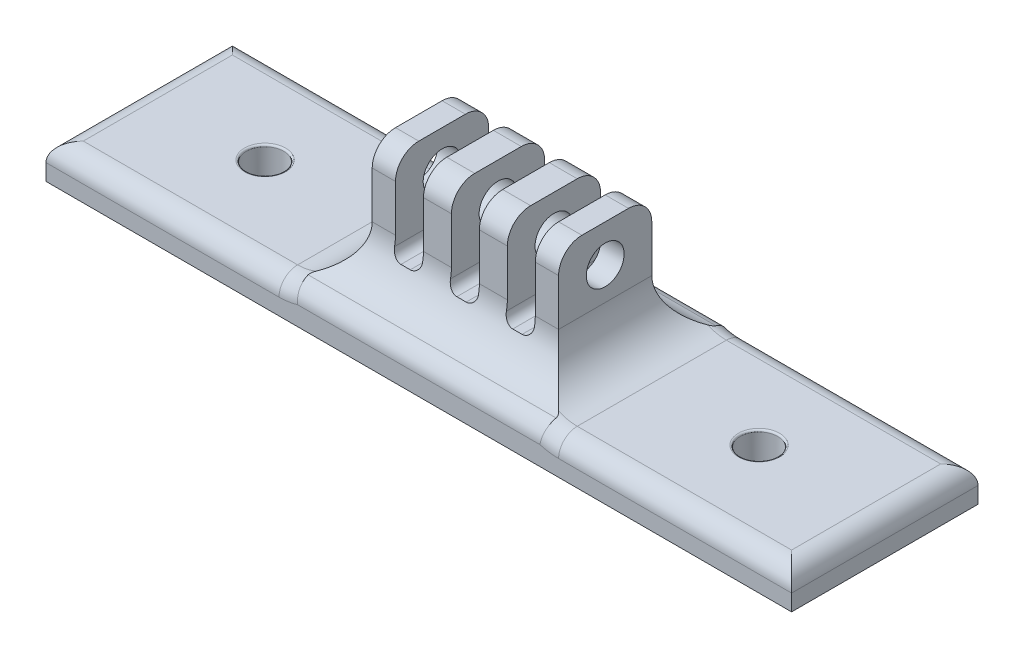
from build123d import *
from build123d.topology import SkipClean

# Parameters (mm, degrees)
SKETCH1_W           = 101.6
SKETCH1_H           = 25.4
BOSS_EXTRUDE1_DEPTH = 4.7625
SKETCH2_W           = 25.4
SKETCH2_H           = 12.7
BOSS_EXTRUDE2_DEPTH = 15.875
SKETCH3_W           = 3.81
SKETCH3_H           = 12.065
CUT_EXTRUDE1_DEPTH  = 25.4
SKETCH4_R           = 2.5781
CUT_EXTRUDE2_DEPTH  = 72.4375
FILLET2_START       = 45.085
FILLET2_DEPTH       = 3.81
FILLET2_START_2     = 52.705
FILLET2_2_DEPTH     = 3.81
FILLET2_START_3     = 38.1
FILLET2_3_DEPTH     = 3.175
FILLET2_START_4     = 60.325
FILLET2_4_DEPTH     = 3.175
FILLET2_START_5     = -25.4
FILLET2_5_OUTLINE_W = 3.81
FILLET2_5_OUTLINE_H = 3.81
FILLET2_5_DEPTH     = 25.4
FILLET2_6_DEPTH     = 101.6
FILLET3_2_DEPTH     = 101.6
FILLET3_3_DEPTH     = 31.75
FILLET3_START       = 69.85
FILLET3_4_DEPTH     = 31.75
FILLET3_START_2     = -26
FILLET3_5_DEPTH     = 27
FILLET4_R           = 3.175
FILLET5_R           = 1.27
SKETCH5_R           = 2.5527
CUT_EXTRUDE3_DEPTH  = 106.923253491
FILLET6_R           = 0.254


with BuildPart() as part:
    # Sketch1 → Boss-Extrude1 (new body)
    with BuildSketch(Plane(origin=(0, 0, 0), x_dir=(1, 0, 0), z_dir=(0, 1, 0))):
        with Locations((50.8, 12.7)):
            Rectangle(SKETCH1_W, SKETCH1_H)
    extrude(amount=BOSS_EXTRUDE1_DEPTH)

    # Sketch2 → Boss-Extrude2 (add)
    with BuildSketch(Plane(origin=(0, 4.7625, 0), x_dir=(1, 0, 0), z_dir=(0, 1, 0))):
        with Locations((50.8, 12.7)):
            Rectangle(SKETCH2_W, SKETCH2_H)
    extrude(amount=BOSS_EXTRUDE2_DEPTH)

    # Sketch3 → Cut-Extrude1 (cut)
    with BuildSketch(Plane.XY.offset(-6.35)):
        with Locations((50.8, 14.605)):
            Rectangle(SKETCH3_W, SKETCH3_H)
        with Locations((43.18, 14.605)):
            Rectangle(SKETCH3_W, SKETCH3_H)
        with Locations((58.42, 14.605)):
            Rectangle(SKETCH3_W, SKETCH3_H)
    extrude(amount=-CUT_EXTRUDE1_DEPTH, mode=Mode.SUBTRACT)

    # Sketch4 → Cut-Extrude2 (cut, through all)
    with BuildSketch(Plane(origin=(63.5, 0, 0), x_dir=(0, 0, -1), z_dir=(1, 0, 0))):
        with Locations((12.7, 15.5575)):
            Circle(SKETCH4_R)
    extrude(amount=-CUT_EXTRUDE2_DEPTH, mode=Mode.SUBTRACT)

    # Fillet2: read off the stored shape, not the designer's step
    # Fillet2 outline → Fillet2 (add)
    with BuildSketch(Plane.YZ.offset(FILLET2_START)):
        with BuildLine():
            Line((4.7625, -6.35), (11.1125, -6.35))
            ThreePointArc((11.1125, -6.35), (6.622371939, -4.490128061), (4.7625, 0))
            Line((4.7625, 0), (4.7625, -6.35))
        make_face()
        with BuildLine():
            Line((11.1125, -19.05), (4.7625, -19.05))
            Line((4.7625, -19.05), (4.7625, -25.4))
            ThreePointArc((4.7625, -25.4), (6.622371939, -20.909871939), (11.1125, -19.05))
        make_face()
    extrude(amount=FILLET2_DEPTH)

    # Fillet2 2 outline → Fillet2 2 (add)
    with BuildSketch(Plane.YZ.offset(FILLET2_START_2)):
        with BuildLine():
            Line((4.7625, -6.35), (11.1125, -6.35))
            ThreePointArc((11.1125, -6.35), (6.622371939, -4.490128061), (4.7625, 0))
            Line((4.7625, 0), (4.7625, -6.35))
        make_face()
        with BuildLine():
            Line((11.1125, -19.05), (4.7625, -19.05))
            Line((4.7625, -19.05), (4.7625, -25.4))
            ThreePointArc((4.7625, -25.4), (6.622371939, -20.909871939), (11.1125, -19.05))
        make_face()
    extrude(amount=FILLET2_2_DEPTH)

    # Fillet2 3 outline → Fillet2 3 (add)
    with BuildSketch(Plane.YZ.offset(FILLET2_START_3)):
        with BuildLine():
            Line((4.7625, -6.35), (11.1125, -6.35))
            ThreePointArc((11.1125, -6.35), (6.622371939, -4.490128061), (4.7625, 0))
            Line((4.7625, 0), (4.7625, -6.35))
        make_face()
        with BuildLine():
            Line((11.1125, -19.05), (4.7625, -19.05))
            Line((4.7625, -19.05), (4.7625, -25.4))
            ThreePointArc((4.7625, -25.4), (6.622371939, -20.909871939), (11.1125, -19.05))
        make_face()
    extrude(amount=FILLET2_3_DEPTH)

    # Fillet2 4 outline → Fillet2 4 (add)
    with BuildSketch(Plane.YZ.offset(FILLET2_START_4)):
        with BuildLine():
            Line((4.7625, -6.35), (11.1125, -6.35))
            ThreePointArc((11.1125, -6.35), (6.622371939, -4.490128061), (4.7625, 0))
            Line((4.7625, 0), (4.7625, -6.35))
        make_face()
        with BuildLine():
            Line((11.1125, -19.05), (4.7625, -19.05))
            Line((4.7625, -19.05), (4.7625, -25.4))
            ThreePointArc((4.7625, -25.4), (6.622371939, -20.909871939), (11.1125, -19.05))
        make_face()
    extrude(amount=FILLET2_4_DEPTH)

    # Fillet2 5 outline → Fillet2 5 (add)
    with BuildSketch(Plane.XY.offset(FILLET2_START_5)):
        with BuildLine():
            ThreePointArc((69.85, 4.7625), (65.359871939, 6.622371939), (63.5, 11.1125))
            Line((63.5, 11.1125), (63.5, 4.7625))
            Line((63.5, 4.7625), (69.85, 4.7625))
        make_face()
        with BuildLine():
            Line((38.1, 4.7625), (38.1, 11.1125))
            ThreePointArc((38.1, 11.1125), (36.240128061, 6.622371939), (31.75, 4.7625))
            Line((31.75, 4.7625), (38.1, 4.7625))
        make_face()
        with Locations((58.42, 6.6675)):
            Rectangle(FILLET2_5_OUTLINE_W, FILLET2_5_OUTLINE_H)
        with Locations((43.18, 6.6675)):
            Rectangle(FILLET2_5_OUTLINE_W, FILLET2_5_OUTLINE_H)
        with Locations((50.8, 6.6675)):
            Rectangle(FILLET2_5_OUTLINE_W, FILLET2_5_OUTLINE_H)
    extrude(amount=FILLET2_5_DEPTH)

    # Fillet2 6 outline → Fillet2 6 (cut)
    with SkipClean():  # the faces are left unmerged after this step: merging them gives an invalid solid
        with BuildSketch(Plane.YZ):
            with BuildLine():
                Line((11.1125, -6.35), (13, -6.35))
                Line((13, -6.35), (13, 0))
                Line((13, 0), (4.7625, 0))
                ThreePointArc((4.7625, 0), (6.622371939, -4.490128061), (11.1125, -6.35))
            make_face()
            with BuildLine():
                Line((4.7625, -25.4), (13, -25.4))
                Line((13, -25.4), (13, -19.05))
                Line((13, -19.05), (11.1125, -19.05))
                ThreePointArc((11.1125, -19.05), (6.622371939, -20.909871939), (4.7625, -25.4))
            make_face()
        extrude(amount=FILLET2_6_DEPTH, mode=Mode.SUBTRACT)
    add(part.part.scale(1), mode=Mode.REPLACE)  # the faces are merged on a copy

    # Fillet3: read off the stored shape, not the designer's step
    # Fillet3 outline → Fillet3 (revolve, cut)
    with BuildSketch(Plane(origin=(31.75, 11.1125, 0), x_dir=(1, 0, 0), z_dir=(0, -1, 0))):
        with BuildLine():
            Line((6.35, 0), (6.35, -2.54))
            ThreePointArc((6.35, -2.54), (7.093948776, -0.743948776), (8.89, 0))
            Line((8.89, 0), (6.35, 0))
        make_face()
        with BuildLine():
            ThreePointArc((8.89, -25.4), (7.093948776, -24.656051224), (6.35, -22.86))
            Line((6.35, -22.86), (6.35, -25.4))
            Line((6.35, -25.4), (8.89, -25.4))
        make_face()
    revolve(axis=Axis((31.75, 11.1125, 0), (0, 0, 1)), mode=Mode.SUBTRACT)

    # Fillet3 2 outline → Fillet3 2 (cut)
    with BuildSketch(Plane.YZ):
        with BuildLine():
            Line((4.7625, 0), (2.593081006, 0))
            ThreePointArc((2.593081006, 0), (4.111021339, -0.503469337), (5.027200718, -1.814285714))
            ThreePointArc((5.027200718, -1.814285714), (4.829023636, -0.916746847), (4.7625, 0))
        make_face()
        with BuildLine():
            Line((2.593081006, -25.4), (4.7625, -25.4))
            ThreePointArc((4.7625, -25.4), (4.829023636, -24.483253153), (5.027200718, -23.585714286))
            ThreePointArc((5.027200718, -23.585714286), (4.111021339, -24.896530663), (2.593081006, -25.4))
        make_face()
    extrude(amount=FILLET3_2_DEPTH, mode=Mode.SUBTRACT)

    # Fillet3 3 outline → Fillet3 3 (cut)
    with BuildSketch(Plane.YZ):
        with BuildLine():
            ThreePointArc((4.7625, -1.218931786), (3.837284915, -0.325602422), (2.593081006, 0))
            Line((2.593081006, 0), (2.2225, 0))
            ThreePointArc((2.2225, 0), (4.018551224, -0.743948776), (4.7625, -2.54))
            Line((4.7625, -2.54), (4.7625, -1.218931786))
        make_face()
        with BuildLine():
            Line((4.7625, -24.181068214), (4.7625, -22.86))
            ThreePointArc((4.7625, -22.86), (4.018551224, -24.656051224), (2.2225, -25.4))
            Line((2.2225, -25.4), (2.593081006, -25.4))
            ThreePointArc((2.593081006, -25.4), (3.837284915, -25.074397578), (4.7625, -24.181068214))
        make_face()
    extrude(amount=FILLET3_3_DEPTH, mode=Mode.SUBTRACT)

    # Fillet3 4 outline → Fillet3 4 (cut)
    with BuildSketch(Plane.YZ.offset(FILLET3_START)):
        with BuildLine():
            ThreePointArc((4.7625, -1.218931786), (3.837284915, -0.325602422), (2.593081006, 0))
            Line((2.593081006, 0), (2.2225, 0))
            ThreePointArc((2.2225, 0), (4.018551224, -0.743948776), (4.7625, -2.54))
            Line((4.7625, -2.54), (4.7625, -1.218931786))
        make_face()
        with BuildLine():
            Line((4.7625, -24.181068214), (4.7625, -22.86))
            ThreePointArc((4.7625, -22.86), (4.018551224, -24.656051224), (2.2225, -25.4))
            Line((2.2225, -25.4), (2.593081006, -25.4))
            ThreePointArc((2.593081006, -25.4), (3.837284915, -25.074397578), (4.7625, -24.181068214))
        make_face()
    extrude(amount=FILLET3_4_DEPTH, mode=Mode.SUBTRACT)

    # Fillet3 5 outline → Fillet3 5 (cut)
    with BuildSketch(Plane.XY.offset(FILLET3_START_2)):
        with BuildLine():
            Line((101.6, 4.7625), (99.06, 4.7625))
            ThreePointArc((99.06, 4.7625), (100.856051224, 4.018551224), (101.6, 2.2225))
            Line((101.6, 2.2225), (101.6, 4.7625))
        make_face()
        with BuildLine():
            ThreePointArc((0, 2.2225), (0.743948776, 4.018551224), (2.54, 4.7625))
            Line((2.54, 4.7625), (0, 4.7625))
            Line((0, 4.7625), (0, 2.2225))
        make_face()
    extrude(amount=FILLET3_5_DEPTH, mode=Mode.SUBTRACT)

    # Fillet3 6 outline → Fillet3 6 (revolve, cut)
    with BuildSketch(Plane(origin=(69.85, 11.1125, 0), x_dir=(1, 0, 0), z_dir=(0, -1, 0))):
        with BuildLine():
            Line((6.35, 0), (6.35, -2.54))
            ThreePointArc((6.35, -2.54), (7.093948776, -0.743948776), (8.89, 0))
            Line((8.89, 0), (6.35, 0))
        make_face()
        with BuildLine():
            ThreePointArc((8.89, -25.4), (7.093948776, -24.656051224), (6.35, -22.86))
            Line((6.35, -22.86), (6.35, -25.4))
            Line((6.35, -25.4), (8.89, -25.4))
        make_face()
    revolve(axis=Axis((69.85, 11.1125, 0), (0, 0, 1)), mode=Mode.SUBTRACT)

    # Fillet4
    fillet4_edges = [part.edges().sort_by_distance(p)[0] for p in [
        (39.6875, 20.6375, -6.35),
        (61.9125, 20.6375, -19.05),
        (46.99, 20.6375, -6.35),
        (54.61, 20.6375, -6.35),
        (61.9125, 20.6375, -6.35),
        (54.61, 20.6375, -19.05),
        (46.99, 20.6375, -19.05),
        (39.6875, 20.6375, -19.05),
    ]]
    fillet(fillet4_edges, radius=FILLET4_R)

    # Fillet5
    fillet5_edges = [part.edges().sort_by_distance(p)[0] for p in [
        (60.325, 8.5725, -12.7),
        (56.515, 8.5725, -12.7),
        (45.085, 8.5725, -12.7),
        (41.275, 8.5725, -12.7),
        (52.705, 8.5725, -12.7),
        (48.895, 8.5725, -12.7),
    ]]
    fillet(fillet5_edges, radius=FILLET5_R)

    # Sketch5 → Cut-Extrude3 (cut, through all)
    with BuildSketch(Plane(origin=(0, 4.7625, 0), x_dir=(1, 0, 0), z_dir=(0, 1, 0))):
        with Locations(Location((17.145, 12.7, 0), (0, 0, 270))):
            Circle(SKETCH5_R)
        with Locations(Location((84.455, 12.7, 0), (0, 0, 270))):
            Circle(SKETCH5_R)
    extrude(amount=-CUT_EXTRUDE3_DEPTH, mode=Mode.SUBTRACT)

    # Fillet6
    fillet6_edges = [part.edges().sort_by_distance(p)[0] for p in [
        (17.145, 4.7625, -15.2527),
        (84.455, 4.7625, -15.2527),
    ]]
    fillet(fillet6_edges, radius=FILLET6_R)


solid = part.part
